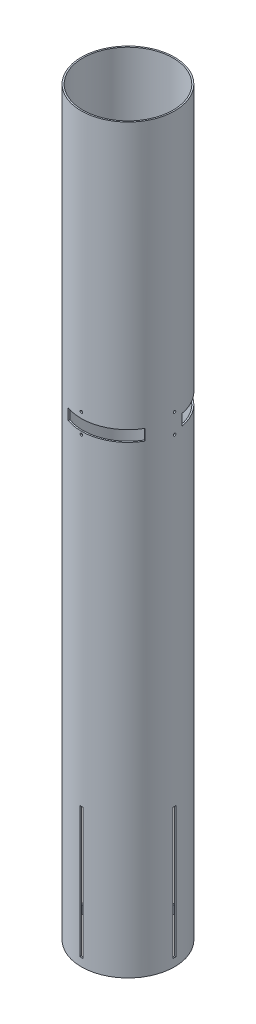
from build123d import *

# Parameters (mm, degrees)
SKETCH1_R              = 51.1048
SKETCH1_R_2            = 49.53
BOSS_EXTRUDE1_DEPTH    = 812.8
CUT_EXTRUDE1_DEPTH     = 817.00688794
CIRPATTERN1_COUNT      = 4
CUT_EXTRUDE2_DEPTH     = 817.00688794
CIRPATTERN2_COUNT      = 4
SKETCH3_R              = 3.175
CUT_EXTRUDE3_DEPTH     = 817.006888053
CUT_EXTRUDE4_START     = 508.635
CUT_EXTRUDE4_DEPTH     = 12.065
CIRPATTERN3_COUNT      = 3
LPATTERN1_COPY_1_DEPTH = 817.00688794
LPATTERN1_COPY_2_DEPTH = 817.00688794
LPATTERN1_COPY_3_DEPTH = 817.00688794
LPATTERN1_COPY_4_DEPTH = 817.00688794


with BuildPart() as part:
    # Sketch1 → Boss-Extrude1 (new body)
    with BuildSketch(Plane(origin=(0, 0, 0), x_dir=(1, 0, 0), z_dir=(0, 1, 0))):
        Circle(SKETCH1_R)
        Circle(SKETCH1_R_2, mode=Mode.SUBTRACT)
    extrude(amount=BOSS_EXTRUDE1_DEPTH)

    # Sketch2 → Cut-Extrude1 (cut, through all)
    with BuildSketch(Plane(origin=(0, 0, 0), x_dir=(0, 0, -1), z_dir=(1, 0, 0))):
        Polygon((0, 8.89), (1.5875, 8.89), (1.5875, 152.4), (-1.5875, 152.4), (-1.5875, 8.89), align=None)
    cut_extrude1 = extrude(amount=-CUT_EXTRUDE1_DEPTH, mode=Mode.SUBTRACT)

    # CirPattern1: Cut-Extrude1 ×4 about axis
    cirpattern1_axis = Axis((0, 0, 0), (0, 1, 0))
    for i in range(1, CIRPATTERN1_COUNT):
        add(cut_extrude1.rotate(cirpattern1_axis, i * 360 / CIRPATTERN1_COUNT), mode=Mode.SUBTRACT)

    # Sketch2<3> → Cut-Extrude2 (cut, through all)
    with BuildSketch(Plane(origin=(0, 0, 0), x_dir=(0, 0, -1), z_dir=(1, 0, 0))):
        with BuildLine():
            ThreePointArc((0, 528.40255), (-0.956397277, 526.093602723), (1.35255, 527.05))
            ThreePointArc((1.35255, 527.05), (0.956397277, 528.006397277), (0, 528.40255))
        make_face()
    cut_extrude2 = extrude(amount=-CUT_EXTRUDE2_DEPTH, mode=Mode.SUBTRACT)

    # CirPattern2: Cut-Extrude2 ×4 about axis
    cirpattern2_axis = Axis((0, 812.8, 0), (0, -1, 0))
    for i in range(1, CIRPATTERN2_COUNT):
        add(cut_extrude2.rotate(cirpattern2_axis, i * 360 / CIRPATTERN2_COUNT), mode=Mode.SUBTRACT)

    # Sketch3 → Cut-Extrude3 (cut, through all)
    with BuildSketch(Plane(origin=(0, 0, 0), x_dir=(0.7071067811865477, 0, -0.7071067811865475), z_dir=(0.7071067811865475, 0, 0.7071067811865477))):
        with Locations((0, 127)):
            Circle(SKETCH3_R)
    extrude(amount=-CUT_EXTRUDE3_DEPTH, mode=Mode.SUBTRACT)

    # Sketch7 → Cut-Extrude4 (cut)
    with BuildSketch(Plane(origin=(0, 0, 0), x_dir=(1, 0, 0), z_dir=(0, 1, 0)).offset(CUT_EXTRUDE4_START)):
        with BuildLine():
            Line((-44.258055055, -25.5524), (-42.894238249, -24.765))
            ThreePointArc((-42.894238249, -24.765), (-48.777528007, 8.60079424), (-31.837270308, 37.942181268))
            Line((-31.837270308, 37.942181268), (-32.849532236, 39.148548057))
            ThreePointArc((-32.849532236, 39.148548057), (-46.026790738, 22.208897258), (-51.086898433, 1.35255))
            ThreePointArc((-51.086898433, 1.35255), (-51.1048, 0), (-51.086898433, -1.35255))
            ThreePointArc((-51.086898433, -1.35255), (-49.184074902, -13.87902587), (-44.258055055, -25.5524))
        make_face()
    cut_extrude4 = extrude(amount=CUT_EXTRUDE4_DEPTH, mode=Mode.SUBTRACT)

    # CirPattern3: Cut-Extrude4 ×3 about axis
    cirpattern3_axis = Axis((0, 812.8, 0), (0, -1, 0))
    for i in range(1, CIRPATTERN3_COUNT):
        add(cut_extrude4.rotate(cirpattern3_axis, i * 360 / CIRPATTERN3_COUNT), mode=Mode.SUBTRACT)

    # LPattern1 copy 1 sketch → LPattern1 copy 1 (cut, through all)
    with BuildSketch(Plane(origin=(0, -21.6916, 0), x_dir=(1, 0, 0), z_dir=(0, 0, 1))):
        with BuildLine():
            ThreePointArc((0, 528.40255), (-0.956397277, 526.093602723), (1.35255, 527.05))
            ThreePointArc((1.35255, 527.05), (0.956397277, 528.006397277), (0, 528.40255))
        make_face()
    extrude(amount=-LPATTERN1_COPY_1_DEPTH, mode=Mode.SUBTRACT)

    # LPattern1 copy 2 sketch → LPattern1 copy 2 (cut, through all)
    with BuildSketch(Plane(origin=(0, -21.6916, 0), x_dir=(0, 0, 1), z_dir=(-1, 0, 0))):
        with BuildLine():
            ThreePointArc((0, 528.40255), (-0.956397277, 526.093602723), (1.35255, 527.05))
            ThreePointArc((1.35255, 527.05), (0.956397277, 528.006397277), (0, 528.40255))
        make_face()
    extrude(amount=-LPATTERN1_COPY_2_DEPTH, mode=Mode.SUBTRACT)

    # LPattern1 copy 3 sketch → LPattern1 copy 3 (cut, through all)
    with BuildSketch(Plane(origin=(0, -21.6916, 0), x_dir=(-1, 0, 0), z_dir=(0, 0, -1))):
        with BuildLine():
            ThreePointArc((0, 528.40255), (-0.956397277, 526.093602723), (1.35255, 527.05))
            ThreePointArc((1.35255, 527.05), (0.956397277, 528.006397277), (0, 528.40255))
        make_face()
    extrude(amount=-LPATTERN1_COPY_3_DEPTH, mode=Mode.SUBTRACT)

    # LPattern1 copy 4 sketch → LPattern1 copy 4 (cut, through all)
    with BuildSketch(Plane(origin=(0, -21.6916, 0), x_dir=(0, 0, -1), z_dir=(1, 0, 0))):
        with BuildLine():
            ThreePointArc((0, 528.40255), (-0.956397277, 526.093602723), (1.35255, 527.05))
            ThreePointArc((1.35255, 527.05), (0.956397277, 528.006397277), (0, 528.40255))
        make_face()
    extrude(amount=-LPATTERN1_COPY_4_DEPTH, mode=Mode.SUBTRACT)


solid = part.part
